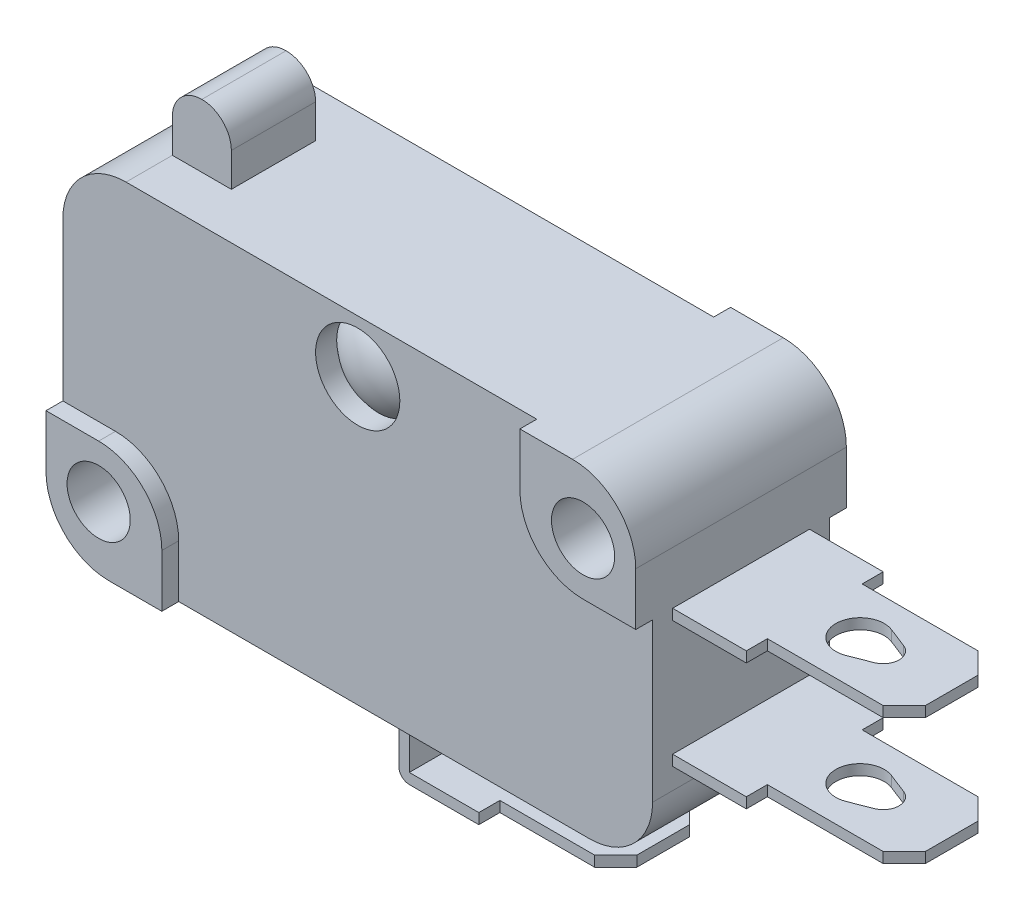
from build123d import *

# Parameters (mm, degrees)
SKETCH_1_W             = 28
SKETCH_1_H             = 16
EXTRUDE_1_DEPTH        = 5
FILLET_1_R             = 3
CUT_EXTRUDE_2_DEPTH    = 0.8
FILLET_2_R             = 3
FILLET_2_OF_MIRROR_1_R = 3
SKETCH_3_R             = 1.5
CUT_EXTRUDE_3_DEPTH    = 19.973665961
SKETCH_4_R             = 2
CUT_EXTRUDE_4_DEPTH    = 0.5
CUT_EXTRUDE_START      = -1
SKETCH_5_R             = 2
CUT_EXTRUDE_5_DEPTH    = 1
SKETCH_10_W            = 6.5
SKETCH_10_H            = 0.5
EXTRUDE_9_DEPTH        = 10
SKETCH_11_W            = 6.5
SKETCH_11_H            = 1
CUT_EXTRUDE_10_DEPTH   = 27.669270706
CHAMFER_1_SIZE         = 1
EXTRUDE_11_DEPTH       = 3.25
FILLET_7_R             = 0.5
SKETCH_13_W            = 5.5
SKETCH_13_H            = 1
CUT_EXTRUDE_12_DEPTH   = 3
CHAMFER_2_SIZE         = 1
SKETCH_14_W            = 2.8
SKETCH_14_H            = 4
EXTRUDE_13_DEPTH       = 3
FILLET_8_R             = 1.4


with BuildPart() as part:
    # 草圖1 → 伸長1 (new, symmetric)
    with BuildSketch(Plane.XY):
        Rectangle(SKETCH_1_W, SKETCH_1_H)
    extrude(amount=EXTRUDE_1_DEPTH, both=True)

    # 圓角1
    fillet_1_edges = [part.edges().sort_by_distance(p)[0] for p in [
        (-14, 8, 0),
        (14, 8, 0),
        (14, -8, 0),
        (-14, -8, 0),
    ]]
    fillet(fillet_1_edges, radius=FILLET_1_R)

    # 草圖2 → 伸長2 (cut)
    with BuildSketch(Plane.XY.offset(5)):
        with BuildLine():
            Line((-14, -2.5), (-8.5, -2.5))
            Line((-8.5, -2.5), (-8.5, -8))
            Line((-8.5, -8), (11, -8))
            ThreePointArc((11, -8), (13.121320344, -7.121320344), (14, -5))
            Line((14, -5), (14, 2.5))
            Line((14, 2.5), (8.5, 2.5))
            Line((8.5, 2.5), (8.5, 8))
            Line((8.5, 8), (-11, 8))
            ThreePointArc((-11, 8), (-13.121320344, 7.121320344), (-14, 5))
            Line((-14, 5), (-14, -2.5))
        make_face()
    cut_extrude_2 = extrude(amount=-CUT_EXTRUDE_2_DEPTH, mode=Mode.SUBTRACT)

    # 圓角2
    fillet_2_edges = [part.edges().sort_by_distance(p)[0] for p in [
        (8.5, 2.5, 4.6),
        (-8.5, -2.5, 4.6),
    ]]
    fillet(fillet_2_edges, radius=FILLET_2_R)

    # 鏡射1: 伸長2 across plane
    add(cut_extrude_2.mirror(Plane.XY), mode=Mode.SUBTRACT)

    # 圓角2 of 鏡射1
    fillet_2_of_mirror_1_edges = [part.edges().sort_by_distance(p)[0] for p in [
        (8.5, 2.5, -4.6),
        (-8.5, -2.5, -4.6),
    ]]
    fillet(fillet_2_of_mirror_1_edges, radius=FILLET_2_OF_MIRROR_1_R)

    # 草圖3 → 伸長3 (cut, through all)
    with BuildSketch(Plane(origin=(0, 0, -5), x_dir=(-1, 0, 0), z_dir=(0, 0, -1))):
        with Locations((-11.5, 5)):
            Circle(SKETCH_3_R)
        with Locations((11.5, -5)):
            Circle(SKETCH_3_R)
    extrude(amount=-CUT_EXTRUDE_3_DEPTH, mode=Mode.SUBTRACT)

    # 草圖4 → 伸長4 (cut)
    with BuildSketch(Plane(origin=(0, 0, -4.2), x_dir=(-1, 0, 0), z_dir=(0, 0, -1))):
        with Locations((0, 5.5)):
            Circle(SKETCH_4_R)
    extrude(amount=-CUT_EXTRUDE_4_DEPTH, mode=Mode.SUBTRACT)

    # 草圖5 → 伸長5 (cut)
    with BuildSketch(Plane.XY.offset(4.2).offset(CUT_EXTRUDE_START)):
        with Locations(Location((0, 5.5, 0), (0, 0, 180))):
            Circle(SKETCH_5_R)
    extrude(amount=CUT_EXTRUDE_5_DEPTH, mode=Mode.SUBTRACT)

    # 草圖9 → 旋轉1 (revolve)
    with BuildSketch(Plane(origin=(0, 5.5, 0), x_dir=(-1, 0, 0), z_dir=(0, 1, 0)), mode=Mode.PRIVATE) as revolve_1_sk:
        with BuildLine():
            Line((0, 3.2), (2, 3.2))
            ThreePointArc((2, 3.2), (1.077032961, 3.792582404), (0, 4))
            Line((0, 4), (0, 3.2))
        make_face()
    revolve(revolve_1_sk.sketch.rotate(Axis((0, 5.5, 3.2), (0, 0, 1)), 180), axis=Axis((0, 5.5, 3.2), (0, 0, 1)))

    # 草圖10 → 伸長9 (add)
    with BuildSketch(Plane(origin=(14, 0, 0), x_dir=(0, 0, -1), z_dir=(1, 0, 0))):
        with Locations((0, -3.75)):
            Rectangle(SKETCH_10_W, SKETCH_10_H)
        with Locations((0, 2.25)):
            Rectangle(SKETCH_10_W, SKETCH_10_H)
    extrude(amount=EXTRUDE_9_DEPTH)

    # 草圖11 → 伸長10 (cut, through all)
    with BuildSketch(Plane(origin=(0, 2.5, 0), x_dir=(1, 0, 0), z_dir=(0, 1, 0))):
        with BuildLine():
            Line((20.068181818, 1.071272126), (21.022727273, 0.698655734))
            ThreePointArc((21.022727273, 0.698655734), (21.5, 0), (21.022727273, -0.698655734))
            Line((21.022727273, -0.698655734), (20.068181818, -1.071272126))
            ThreePointArc((20.068181818, -1.071272126), (18.5, 0), (20.068181818, 1.071272126))
        make_face()
        with Locations((20.75, 2.75)):
            Rectangle(SKETCH_11_W, SKETCH_11_H)
        with Locations((20.75, -2.75)):
            Rectangle(SKETCH_11_W, SKETCH_11_H)
    extrude(amount=-CUT_EXTRUDE_10_DEPTH, mode=Mode.SUBTRACT)

    # 導角1
    chamfer_1_edges = [part.edges().sort_by_distance(p)[0] for p in [
        (24, 2.25, -2.25),
        (24, -3.75, -2.25),
        (24, 2.25, 2.25),
        (24, -3.75, 2.25),
    ]]
    chamfer(chamfer_1_edges, length=CHAMFER_1_SIZE)

    # 草圖12 → 伸長11 (add, symmetric)
    with BuildSketch(Plane.XY):
        Polygon((1, -8), (1.5, -8), (1.5, -10.5), (10.3, -10.5), (10.3, -11), (1, -11), align=None)
    extrude(amount=EXTRUDE_11_DEPTH, both=True)

    # 圓角7
    fillet_7_edges = [part.edges().sort_by_distance(p)[0] for p in [
        (1, -11, 0),
    ]]
    fillet(fillet_7_edges, radius=FILLET_7_R)

    # 草圖13 → 伸長12 (cut)
    with BuildSketch(Plane.XZ.offset(11)):
        with Locations((7.55, 2.75)):
            Rectangle(SKETCH_13_W, SKETCH_13_H)
        with Locations((7.55, -2.75)):
            Rectangle(SKETCH_13_W, SKETCH_13_H)
        with BuildLine():
            Line((6.368181818, 1.071272126), (7.322727273, 0.698655734))
            ThreePointArc((7.322727273, 0.698655734), (7.8, 0), (7.322727273, -0.698655734))
            Line((7.322727273, -0.698655734), (6.368181818, -1.071272126))
            ThreePointArc((6.368181818, -1.071272126), (4.8, 0), (6.368181818, 1.071272126))
        make_face()
    extrude(amount=-CUT_EXTRUDE_12_DEPTH, mode=Mode.SUBTRACT)

    # 導角2
    chamfer_2_edges = [part.edges().sort_by_distance(p)[0] for p in [
        (10.3, -10.75, 2.25),
        (10.3, -10.75, -2.25),
    ]]
    chamfer(chamfer_2_edges, length=CHAMFER_2_SIZE)

    # 草圖14 → 伸長13 (add)
    with BuildSketch(Plane(origin=(0, 8, 0), x_dir=(1, 0, 0), z_dir=(0, 1, 0))):
        with Locations((-9.6, 0)):
            Rectangle(SKETCH_14_W, SKETCH_14_H)
    extrude(amount=EXTRUDE_13_DEPTH)

    # 圓角8
    fillet_8_edges = [part.edges().sort_by_distance(p)[0] for p in [
        (-8.2, 11, 0),
        (-11, 11, 0),
    ]]
    fillet(fillet_8_edges, radius=FILLET_8_R - 0.0001)  # a hair under: the kernel refuses the full size


solid = part.part
